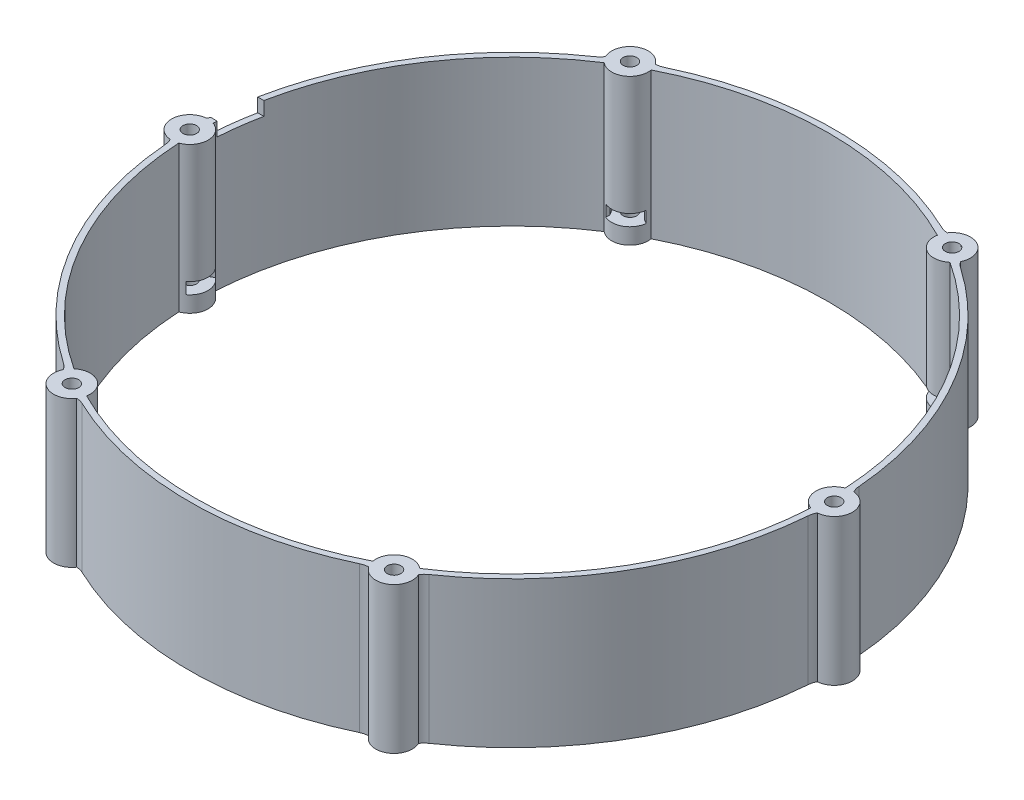
from build123d import *

# Parameters (mm, degrees)
SKETCH_1_R               = 1.5
SKETCH_1_R_2             = 4.5
EXTRUDE_1_DEPTH          = 4
FILLET_1_R               = 4
FILLET_2_R               = 4
EXTRUDE_START            = 5
EXTRUDE_2_DEPTH          = 5
CHAMFER_1_SIZE           = 0.5
EXTRUDE_START_2          = 10
SKETCH_3_R               = 1.5
EXTRUDE_3_DEPTH          = 10
CUT_EXTRUDE_1_DEPTH      = 7
CUT_EXTRUDE_1_DEPTH_BACK = 10
SKETCH_4_W               = 227.71066379
SKETCH_4_H               = 177.705724634
EXTRUDE_4_DEPTH          = 2.5
SKETCH_7_R               = 85.196987133
CUT_EXTRUDE_2_DEPTH      = 6.5
SKETCH_8_R               = 1.5
EXTRUDE_5_DEPTH          = 26
SKETCH_14_W              = 14.044577298
SKETCH_14_H              = 9
CUT_EXTRUDE_4_DEPTH      = 3


with BuildPart() as part:
    # 草图1 → 凸台-拉伸1 (new body)
    with BuildSketch(Plane(origin=(0, 0, 0), x_dir=(1, 0, 0), z_dir=(0, 1, 0))):
        with BuildLine():
            ThreePointArc((-70.5, 3), (-73.5, 0), (-70.5, -3))
            ThreePointArc((-70.5, -3), (-61.110044183, -35.281900459), (-37.848076211, -59.554790967))
            ThreePointArc((-37.848076211, -59.554790967), (-36.75, -63.652867178), (-32.651923789, -62.554790967))
            ThreePointArc((-32.651923789, -62.554790967), (0, -70.563800918), (32.651923789, -62.554790967))
            ThreePointArc((32.651923789, -62.554790967), (36.75, -63.652867178), (37.848076211, -59.554790967))
            ThreePointArc((37.848076211, -59.554790967), (61.110044183, -35.281900459), (70.5, -3))
            ThreePointArc((70.5, -3), (73.5, 0), (70.5, 3))
            ThreePointArc((70.5, 3), (61.110044183, 35.281900459), (37.848076211, 59.554790967))
            ThreePointArc((37.848076211, 59.554790967), (36.75, 63.652867178), (32.651923789, 62.554790967))
            ThreePointArc((32.651923789, 62.554790967), (0, 70.563800918), (-32.651923789, 62.554790967))
            ThreePointArc((-32.651923789, 62.554790967), (-36.75, 63.652867178), (-37.848076211, 59.554790967))
            ThreePointArc((-37.848076211, 59.554790967), (-61.110044183, 35.281900459), (-70.5, 3))
        make_face()
        with Locations(Location((-8, 0, 0), (0, 0, 270))):
            Circle(SKETCH_1_R, mode=Mode.SUBTRACT)
        with Locations(Location((0, 8, 0), (0, 0, 270))):
            Circle(SKETCH_1_R, mode=Mode.SUBTRACT)
        with Locations(Location((8, 0, 0), (0, 0, 270))):
            Circle(SKETCH_1_R, mode=Mode.SUBTRACT)
        with Locations(Location((0, -8, 0), (0, 0, 270))):
            Circle(SKETCH_1_R, mode=Mode.SUBTRACT)
        with Locations(Location((-70.5, 0, 0), (0, 0, 270))):
            Circle(SKETCH_1_R, mode=Mode.SUBTRACT)
        with Locations(Location((-35.25, 61.054790967, 0), (0, 0, 270))):
            Circle(SKETCH_1_R, mode=Mode.SUBTRACT)
        with Locations(Location((35.25, 61.054790967, 0), (0, 0, 270))):
            Circle(SKETCH_1_R, mode=Mode.SUBTRACT)
        with Locations(Location((70.5, 0, 0), (0, 0, 270))):
            Circle(SKETCH_1_R, mode=Mode.SUBTRACT)
        with Locations(Location((35.25, -61.054790967, 0), (0, 0, 270))):
            Circle(SKETCH_1_R, mode=Mode.SUBTRACT)
        with Locations(Location((-35.25, -61.054790967, 0), (0, 0, 270))):
            Circle(SKETCH_1_R, mode=Mode.SUBTRACT)
        with Locations(Location((0, 0, 0), (0, 0, 270))):
            Circle(SKETCH_1_R_2, mode=Mode.SUBTRACT)
        with BuildLine():
            Line((-9.579036496, 4.300239505), (-67.362882511, 4.300239505))
            ThreePointArc((-67.362882511, 4.300239505), (-58.456714755, 33.75), (-37.405557909, 56.187847774))
            Line((-37.405557909, 56.187847774), (-8.513634902, 6.145569197))
            ThreePointArc((-8.513634902, 6.145569197), (-9.09326674, 5.25), (-9.579036496, 4.300239505))
        make_face(mode=Mode.SUBTRACT)
        with BuildLine():
            Line((-9.579036496, -4.300239505), (-67.362882511, -4.300239505))
            ThreePointArc((-67.362882511, -4.300239505), (-58.456714755, -33.75), (-37.405557909, -56.187847774))
            Line((-37.405557909, -56.187847774), (-8.513634902, -6.145569197))
            ThreePointArc((-8.513634902, -6.145569197), (-9.09326674, -5.25), (-9.579036496, -4.300239505))
        make_face(mode=Mode.SUBTRACT)
        with BuildLine():
            Line((67.362882511, -4.300239505), (9.579036496, -4.300239505))
            ThreePointArc((9.579036496, -4.300239505), (9.09326674, -5.25), (8.513634902, -6.145569197))
            Line((8.513634902, -6.145569197), (37.405557909, -56.187847774))
            ThreePointArc((37.405557909, -56.187847774), (58.456714755, -33.75), (67.362882511, -4.300239505))
        make_face(mode=Mode.SUBTRACT)
        with BuildLine():
            Line((67.362882511, 4.300239505), (9.579036496, 4.300239505))
            ThreePointArc((9.579036496, 4.300239505), (9.09326674, 5.25), (8.513634902, 6.145569197))
            Line((8.513634902, 6.145569197), (37.405557909, 56.187847774))
            ThreePointArc((37.405557909, 56.187847774), (58.456714755, 33.75), (67.362882511, 4.300239505))
        make_face(mode=Mode.SUBTRACT)
        with BuildLine():
            Line((-1.065401594, 10.445808702), (-29.957324602, 60.488087279))
            ThreePointArc((-29.957324602, 60.488087279), (0, 67.5), (29.957324602, 60.488087279))
            Line((29.957324602, 60.488087279), (1.065401594, 10.445808702))
            ThreePointArc((1.065401594, 10.445808702), (0, 10.5), (-1.065401594, 10.445808702))
        make_face(mode=Mode.SUBTRACT)
        with BuildLine():
            Line((29.957324602, -60.488087279), (1.065401594, -10.445808702))
            ThreePointArc((1.065401594, -10.445808702), (0, -10.5), (-1.065401594, -10.445808702))
            Line((-1.065401594, -10.445808702), (-29.957324602, -60.488087279))
            ThreePointArc((-29.957324602, -60.488087279), (0, -67.5), (29.957324602, -60.488087279))
        make_face(mode=Mode.SUBTRACT)
        with BuildLine():
            Line((-32.799038106, -53.809600438), (-7.799038106, -10.508330249))
            ThreePointArc((-7.799038106, -10.508330249), (-5.75, -9.959292144), (-5.200961894, -12.008330249))
            Line((-5.200961894, -12.008330249), (-30.200961894, -55.309600438))
            ThreePointArc((-30.200961894, -55.309600438), (-32.25, -55.858638544), (-32.799038106, -53.809600438))
        make_face(mode=Mode.SUBTRACT)
        with BuildLine():
            Line((-63, 1.5), (-13, 1.5))
            ThreePointArc((-13, 1.5), (-11.5, 0), (-13, -1.5))
            Line((-13, -1.5), (-63, -1.5))
            ThreePointArc((-63, -1.5), (-64.5, 0), (-63, 1.5))
        make_face(mode=Mode.SUBTRACT)
        with BuildLine():
            Line((-30.200961894, 55.309600438), (-5.200961894, 12.008330249))
            ThreePointArc((-5.200961894, 12.008330249), (-5.75, 9.959292144), (-7.799038106, 10.508330249))
            Line((-7.799038106, 10.508330249), (-32.799038106, 53.809600438))
            ThreePointArc((-32.799038106, 53.809600438), (-32.25, 55.858638544), (-30.200961894, 55.309600438))
        make_face(mode=Mode.SUBTRACT)
        with BuildLine():
            Line((32.799038106, 53.809600438), (7.799038106, 10.508330249))
            ThreePointArc((7.799038106, 10.508330249), (5.75, 9.959292144), (5.200961894, 12.008330249))
            Line((5.200961894, 12.008330249), (30.200961894, 55.309600438))
            ThreePointArc((30.200961894, 55.309600438), (32.25, 55.858638544), (32.799038106, 53.809600438))
        make_face(mode=Mode.SUBTRACT)
        with BuildLine():
            Line((63, -1.5), (13, -1.5))
            ThreePointArc((13, -1.5), (11.5, 0), (13, 1.5))
            Line((13, 1.5), (63, 1.5))
            ThreePointArc((63, 1.5), (64.5, 0), (63, -1.5))
        make_face(mode=Mode.SUBTRACT)
        with BuildLine():
            Line((30.200961894, -55.309600438), (5.200961894, -12.008330249))
            ThreePointArc((5.200961894, -12.008330249), (5.75, -9.959292144), (7.799038106, -10.508330249))
            Line((7.799038106, -10.508330249), (32.799038106, -53.809600438))
            ThreePointArc((32.799038106, -53.809600438), (32.25, -55.858638544), (30.200961894, -55.309600438))
        make_face(mode=Mode.SUBTRACT)
    extrude(amount=EXTRUDE_1_DEPTH)

    # 圆角1
    fillet_1_edges = [part.edges().sort_by_distance(p)[0] for p in [
        (-32.651923789, 2, -62.554790967),
        (32.651923789, 2, -62.554790967),
        (37.848076211, 2, -59.554790967),
        (70.5, 2, -3),
        (70.5, 2, 3),
        (37.848076211, 2, 59.554790967),
        (32.651923789, 2, 62.554790967),
        (-32.651923789, 2, 62.554790967),
        (-37.848076211, 2, 59.554790967),
        (-70.5, 2, 3),
        (-70.5, 2, -3),
        (-37.848076211, 2, -59.554790967),
        (29.957324602, 2, 60.488087279),
        (-29.957324602, 2, 60.488087279),
        (67.362882511, 2, 4.300239505),
        (37.405557909, 2, 56.187847774),
        (37.405557909, 2, -56.187847774),
        (67.362882511, 2, -4.300239505),
        (-29.957324602, 2, -60.488087279),
        (29.957324602, 2, -60.488087279),
        (-67.362882511, 2, -4.300239505),
        (-37.405557909, 2, -56.187847774),
        (-67.362882511, 2, 4.300239505),
        (-37.405557909, 2, 56.187847774),
    ]]
    fillet(fillet_1_edges, radius=FILLET_1_R)

    # 圆角2
    # the kernel refuses this fillet: 4 mm, written as the material it adds along each edge
    with BuildSketch(Plane(origin=(-1.065401594, 0, 10.445808702), x_dir=(-0.5000000000000071, 0, 0.8660254037844346), z_dir=(0, 1, 0)), Plane(origin=(-9.579036496, 0, 4.300239505), x_dir=(-1, 0, 0), z_dir=(0, 1, 0)), Plane(origin=(-8.513634902, 0, -6.145569197), x_dir=(-0.4999999999999958, 0, -0.866025403784441), z_dir=(0, 1, 0)), Plane(origin=(1.065401594, 0, -10.445808702), x_dir=(0.5000000000000073, 0, -0.8660254037844344), z_dir=(0, 1, 0)), Plane(origin=(9.579036496, 0, -4.300239505), x_dir=(1, 0, 0), z_dir=(0, 1, 0)), Plane(origin=(8.513634902, 0, 6.145569197), x_dir=(0.4999999999999941, 0, 0.866025403784442), z_dir=(0, 1, 0))) as fillet_2_piece_1:
        with BuildLine():
            CenterArc((2.310287461, 4), FILLET_2_R, 214.919873181, 55.080126819)
            ThreePointArc((-0.969526045, 1.710278757), (-0.444646896, 0.877880484), (0, 0))
            Line((0, 0), (2.310287461, 0))
        make_face()
    extrude(amount=4)
    with BuildSketch(Plane(origin=(-8.513634902, 0, 6.145569197), x_dir=(-0.5068146140540679, 0, -0.8620550718957729), z_dir=(0, 1, 0)), Plane(origin=(-9.579036496, 0, -4.300239505), x_dir=(0.49315428469593503, 0, -0.86994186672791), z_dir=(0, 1, 0)), Plane(origin=(-1.065401594, 0, -10.445808702), x_dir=(0.9999688987499935, 0, -0.007886794832196306), z_dir=(0, 1, 0)), Plane(origin=(8.513634902, 0, -6.145569197), x_dir=(0.5068146140541091, 0, 0.8620550718957487), z_dir=(0, 1, 0)), Plane(origin=(9.579036496, 0, 4.300239505), x_dir=(-0.49315428469592015, 0, 0.8699418667279183), z_dir=(0, 1, 0))) as fillet_2_piece_2:
        with BuildLine():
            CenterArc((2.340439307, 3.982432925), FILLET_2_R, 209.548115257, 55.080126819)
            Line((-1.13932816, 2.009815786), (0, 0))
            ThreePointArc((0, 0), (0.982984509, 0.046113572), (1.965969018, 0))
        make_face()
    extrude(amount=4)
    with BuildSketch(Plane(origin=(1.065401594, 0, 10.445808702), x_dir=(0.4999999999999959, 0, 0.8660254037844409), z_dir=(0, 1, 0))) as fillet_2_piece_3:
        with BuildLine():
            CenterArc((2.310287461, -4), FILLET_2_R, 90, 55.080126819)
            ThreePointArc((-0.969526045, -1.710278757), (-0.444646896, -0.877880484), (0, 0))
            Line((0, 0), (2.310287461, 0))
        make_face()
    extrude(amount=4)

    # 草图2 → 凸台-拉伸2 (add)
    with BuildSketch(Plane(origin=(0, 0, 0), x_dir=(-1, 0, 0), z_dir=(0, -1, 0)).offset(EXTRUDE_START)):
        with BuildLine():
            Line((23.086359674, -63.429251903), (23.599389889, -64.838790834))
            ThreePointArc((23.599389889, -64.838790834), (0, -69), (-23.599389889, -64.838790834))
            Line((-23.599389889, -64.838790834), (-23.086359674, -63.429251903))
            ThreePointArc((-23.086359674, -63.429251903), (0, -67.5), (23.086359674, -63.429251903))
        make_face()
        with BuildLine():
            Line((-43.388163654, -51.707999911), (-44.352345068, -52.857066575))
            ThreePointArc((-44.352345068, -52.857066575), (-59.755752861, -34.5), (-67.951734958, -11.981724259))
            Line((-67.951734958, -11.981724259), (-66.474523328, -11.721251993))
            ThreePointArc((-66.474523328, -11.721251993), (-58.456714755, -33.75), (-43.388163654, -51.707999911))
        make_face()
        with BuildLine():
            Line((-66.474523328, 11.721251993), (-67.951734958, 11.981724259))
            ThreePointArc((-67.951734958, 11.981724259), (-59.755752861, 34.5), (-44.352345068, 52.857066575))
            Line((-44.352345068, 52.857066575), (-43.388163654, 51.707999911))
            ThreePointArc((-43.388163654, 51.707999911), (-58.456714755, 33.75), (-66.474523328, 11.721251993))
        make_face()
        with BuildLine():
            Line((-23.086359674, 63.429251903), (-23.599389889, 64.838790834))
            ThreePointArc((-23.599389889, 64.838790834), (0, 69), (23.599389889, 64.838790834))
            Line((23.599389889, 64.838790834), (23.086359674, 63.429251903))
            ThreePointArc((23.086359674, 63.429251903), (0, 67.5), (-23.086359674, 63.429251903))
        make_face()
        with BuildLine():
            Line((43.388163654, 51.707999911), (44.352345068, 52.857066575))
            ThreePointArc((44.352345068, 52.857066575), (59.755752861, 34.5), (67.951734958, 11.981724259))
            Line((67.951734958, 11.981724259), (66.474523328, 11.721251993))
            ThreePointArc((66.474523328, 11.721251993), (58.456714755, 33.75), (43.388163654, 51.707999911))
        make_face()
        with BuildLine():
            Line((66.474523328, -11.721251993), (67.951734958, -11.981724259))
            ThreePointArc((67.951734958, -11.981724259), (59.755752861, -34.5), (44.352345068, -52.857066575))
            Line((44.352345068, -52.857066575), (43.388163654, -51.707999911))
            ThreePointArc((43.388163654, -51.707999911), (58.456714755, -33.75), (66.474523328, -11.721251993))
        make_face()
    extrude(amount=-EXTRUDE_2_DEPTH)

    # 倒角1
    chamfer_1_edges = [part.edges().sort_by_distance(p)[0] for p in [
        (0, -5, 69),
        (59.755752861, -5, 34.5),
        (59.755752861, -5, -34.5),
        (0, -5, -69),
        (-59.755752861, -5, -34.5),
        (-59.755752861, -5, 34.5),
    ]]
    chamfer(chamfer_1_edges, length=CHAMFER_1_SIZE)

    # 草图4 → 切除-拉伸1 (cut, two sides: drawn at the far end of the back side and taken through both)
    with BuildSketch(Plane(origin=(0, 0, 0), x_dir=(-1, 0, 0), z_dir=(0, -1, 0)).offset(-CUT_EXTRUDE_1_DEPTH_BACK)):
        Rectangle(SKETCH_4_W, SKETCH_4_H)
    extrude(amount=CUT_EXTRUDE_1_DEPTH + CUT_EXTRUDE_1_DEPTH_BACK, mode=Mode.SUBTRACT)


with BuildPart() as body_2:
    # 草图3 → 凸台-拉伸3 (new body)
    with BuildSketch(Plane.XZ.offset(EXTRUDE_START_2)):
        with BuildLine():
            ThreePointArc((70.796400557, -3.989003223), (74.5, 0), (70.796400557, 3.989003223))
            ThreePointArc((70.796400557, 3.989003223), (70.49170404, 4.742901972), (70.345766695, 5.542842958))
            ThreePointArc((70.345766695, 5.542842958), (61.110044183, 35.281900459), (39.973126159, 58.149799528))
            ThreePointArc((39.973126159, 58.149799528), (39.353325615, 58.676155469), (38.852778405, 59.316979767))
            ThreePointArc((38.852778405, 59.316979767), (37.25, 64.518892582), (31.943622152, 63.30598299))
            ThreePointArc((31.943622152, 63.30598299), (31.138378425, 63.419057441), (30.372640536, 63.692642486))
            ThreePointArc((30.372640536, 63.692642486), (0, 70.563800918), (-30.372640536, 63.692642486))
            ThreePointArc((-30.372640536, 63.692642486), (-31.138378425, 63.419057441), (-31.943622152, 63.30598299))
            ThreePointArc((-31.943622152, 63.30598299), (-37.25, 64.518892582), (-38.852778405, 59.316979767))
            ThreePointArc((-38.852778405, 59.316979767), (-39.353325615, 58.676155469), (-39.973126159, 58.149799528))
            ThreePointArc((-39.973126159, 58.149799528), (-61.110044183, 35.281900459), (-70.345766695, 5.542842958))
            ThreePointArc((-70.345766695, 5.542842958), (-70.49170404, 4.742901972), (-70.796400557, 3.989003223))
            ThreePointArc((-70.796400557, 3.989003223), (-74.5, 0), (-70.796400557, -3.989003223))
            ThreePointArc((-70.796400557, -3.989003223), (-70.49170404, -4.742901972), (-70.345766695, -5.542842958))
            ThreePointArc((-70.345766695, -5.542842958), (-61.110044183, -35.281900459), (-39.973126159, -58.149799528))
            ThreePointArc((-39.973126159, -58.149799528), (-39.353325615, -58.676155469), (-38.852778405, -59.316979767))
            ThreePointArc((-38.852778405, -59.316979767), (-37.25, -64.518892582), (-31.943622152, -63.30598299))
            ThreePointArc((-31.943622152, -63.30598299), (-31.138378425, -63.419057441), (-30.372640536, -63.692642486))
            ThreePointArc((-30.372640536, -63.692642486), (0, -70.563800918), (30.372640536, -63.692642486))
            ThreePointArc((30.372640536, -63.692642486), (31.138378425, -63.419057441), (31.943622152, -63.30598299))
            ThreePointArc((31.943622152, -63.30598299), (37.25, -64.518892582), (38.852778405, -59.316979767))
            ThreePointArc((38.852778405, -59.316979767), (39.353325615, -58.676155469), (39.973126159, -58.149799528))
            ThreePointArc((39.973126159, -58.149799528), (61.110044183, -35.281900459), (70.345766695, -5.542842958))
            ThreePointArc((70.345766695, -5.542842958), (70.49170404, -4.742901972), (70.796400557, -3.989003223))
        make_face()
        with Locations(Location((70.5, 0, 0), (0, 0, 270))):
            Circle(SKETCH_3_R, mode=Mode.SUBTRACT)
        with Locations(Location((35.25, 61.054790967, 0), (0, 0, 270))):
            Circle(SKETCH_3_R, mode=Mode.SUBTRACT)
        with Locations(Location((-35.25, 61.054790967, 0), (0, 0, 270))):
            Circle(SKETCH_3_R, mode=Mode.SUBTRACT)
        with Locations(Location((-70.5, 0, 0), (0, 0, 270))):
            Circle(SKETCH_3_R, mode=Mode.SUBTRACT)
        with Locations(Location((-35.25, -61.054790967, 0), (0, 0, 270))):
            Circle(SKETCH_3_R, mode=Mode.SUBTRACT)
        with Locations(Location((35.25, -61.054790967, 0), (0, 0, 270))):
            Circle(SKETCH_3_R, mode=Mode.SUBTRACT)
        with BuildLine():
            ThreePointArc((-37.833906507, 58.001362212), (-59.972259212, 34.625), (-69.147606383, 3.764443054))
            ThreePointArc((-69.147606383, 3.764443054), (-66.5, 0), (-69.147606383, -3.764443054))
            ThreePointArc((-69.147606383, -3.764443054), (-59.972259212, -34.625), (-37.833906507, -58.001362212))
            ThreePointArc((-37.833906507, -58.001362212), (-33.25, -57.590689352), (-31.313699876, -61.765805265))
            ThreePointArc((-31.313699876, -61.765805265), (0, -69.25), (31.313699876, -61.765805265))
            ThreePointArc((31.313699876, -61.765805265), (33.25, -57.590689352), (37.833906507, -58.001362212))
            ThreePointArc((37.833906507, -58.001362212), (59.972259212, -34.625), (69.147606383, -3.764443054))
            ThreePointArc((69.147606383, -3.764443054), (66.5, 0), (69.147606383, 3.764443054))
            ThreePointArc((69.147606383, 3.764443054), (59.972259212, 34.625), (37.833906507, 58.001362212))
            ThreePointArc((37.833906507, 58.001362212), (33.25, 57.590689352), (31.313699876, 61.765805265))
            ThreePointArc((31.313699876, 61.765805265), (0, 69.25), (-31.313699876, 61.765805265))
            ThreePointArc((-31.313699876, 61.765805265), (-33.25, 57.590689352), (-37.833906507, 58.001362212))
        make_face(mode=Mode.SUBTRACT)
    extrude(amount=EXTRUDE_3_DEPTH)

    # 草图5 → 凸台-拉伸4 (add)
    with BuildSketch(Plane(origin=(0, -10, 0), x_dir=(1, 0, 0), z_dir=(0, 1, 0))):
        with BuildLine():
            ThreePointArc((30.372640536, 63.692642486), (0, 70.563800918), (-30.372640536, 63.692642486))
            ThreePointArc((-30.372640536, 63.692642486), (-31.138378425, 63.419057441), (-31.943622152, 63.30598299))
            ThreePointArc((-31.943622152, 63.30598299), (-37.25, 64.518892582), (-38.852778405, 59.316979767))
            ThreePointArc((-38.852778405, 59.316979767), (-39.353325615, 58.676155469), (-39.973126159, 58.149799528))
            ThreePointArc((-39.973126159, 58.149799528), (-61.110044183, 35.281900459), (-70.345766695, 5.542842958))
            ThreePointArc((-70.345766695, 5.542842958), (-70.49170404, 4.742901972), (-70.796400557, 3.989003223))
            ThreePointArc((-70.796400557, 3.989003223), (-74.5, 0), (-70.796400557, -3.989003223))
            ThreePointArc((-70.796400557, -3.989003223), (-70.49170404, -4.742901972), (-70.345766695, -5.542842958))
            ThreePointArc((-70.345766695, -5.542842958), (-61.110044183, -35.281900459), (-39.973126159, -58.149799528))
            ThreePointArc((-39.973126159, -58.149799528), (-39.353325615, -58.676155469), (-38.852778405, -59.316979767))
            ThreePointArc((-38.852778405, -59.316979767), (-37.25, -64.518892582), (-31.943622152, -63.30598299))
            ThreePointArc((-31.943622152, -63.30598299), (-31.138378425, -63.419057441), (-30.372640536, -63.692642486))
            ThreePointArc((-30.372640536, -63.692642486), (0, -70.563800918), (30.372640536, -63.692642486))
            ThreePointArc((30.372640536, -63.692642486), (31.138378425, -63.419057441), (31.943622152, -63.30598299))
            ThreePointArc((31.943622152, -63.30598299), (37.25, -64.518892582), (38.852778405, -59.316979767))
            ThreePointArc((38.852778405, -59.316979767), (39.353325615, -58.676155469), (39.973126159, -58.149799528))
            ThreePointArc((39.973126159, -58.149799528), (61.110044183, -35.281900459), (70.345766695, -5.542842958))
            ThreePointArc((70.345766695, -5.542842958), (70.49170404, -4.742901972), (70.796400557, -3.989003223))
            ThreePointArc((70.796400557, -3.989003223), (74.5, 0), (70.796400557, 3.989003223))
            ThreePointArc((70.796400557, 3.989003223), (70.49170404, 4.742901972), (70.345766695, 5.542842958))
            ThreePointArc((70.345766695, 5.542842958), (61.110044183, 35.281900459), (39.973126159, 58.149799528))
            ThreePointArc((39.973126159, 58.149799528), (39.353325615, 58.676155469), (38.852778405, 59.316979767))
            ThreePointArc((38.852778405, 59.316979767), (37.25, 64.518892582), (31.943622152, 63.30598299))
            ThreePointArc((31.943622152, 63.30598299), (31.138378425, 63.419057441), (30.372640536, 63.692642486))
        make_face()
        with BuildLine():
            Line((-32.016838493, 61.054790967), (-33.633419246, 63.854790967))
            Line((-33.633419246, 63.854790967), (-36.866580754, 63.854790967))
            Line((-36.866580754, 63.854790967), (-38.483161507, 61.054790967))
            Line((-38.483161507, 61.054790967), (-36.866580754, 58.254790967))
            Line((-36.866580754, 58.254790967), (-36.866580754, 57.396011571))
            ThreePointArc((-36.866580754, 57.396011571), (-37.371941483, 57.664014604), (-37.833906507, 58.001362212))
            ThreePointArc((-37.833906507, 58.001362212), (-59.972259212, 34.625), (-69.147606383, 3.764443054))
            ThreePointArc((-69.147606383, 3.764443054), (-68.624472273, 3.533043411), (-68.139694473, 3.229389698))
            Line((-68.139694473, 3.229389698), (-68.883419246, 2.8))
            Line((-68.883419246, 2.8), (-72.116580754, 2.8))
            Line((-72.116580754, 2.8), (-73.733161507, 0))
            Line((-73.733161507, 0), (-72.116580754, -2.8))
            Line((-72.116580754, -2.8), (-68.883419246, -2.8))
            Line((-68.883419246, -2.8), (-68.139694473, -3.229389698))
            ThreePointArc((-68.139694473, -3.229389698), (-68.624472273, -3.533043411), (-69.147606383, -3.764443054))
            ThreePointArc((-69.147606383, -3.764443054), (-59.972259212, -34.625), (-37.833906507, -58.001362212))
            ThreePointArc((-37.833906507, -58.001362212), (-37.371941483, -57.664014604), (-36.866580754, -57.396011571))
            Line((-36.866580754, -57.396011571), (-36.866580754, -58.254790967))
            Line((-36.866580754, -58.254790967), (-38.483161507, -61.054790967))
            Line((-38.483161507, -61.054790967), (-36.866580754, -63.854790967))
            Line((-36.866580754, -63.854790967), (-33.633419246, -63.854790967))
            Line((-33.633419246, -63.854790967), (-32.016838493, -61.054790967))
            Line((-32.016838493, -61.054790967), (-31.27311372, -60.625401269))
            ThreePointArc((-31.27311372, -60.625401269), (-31.25253079, -61.197058015), (-31.313699876, -61.765805265))
            ThreePointArc((-31.313699876, -61.765805265), (0, -69.25), (31.313699876, -61.765805265))
            ThreePointArc((31.313699876, -61.765805265), (31.25253079, -61.197058015), (31.27311372, -60.625401269))
            Line((31.27311372, -60.625401269), (32.016838493, -61.054790967))
            Line((32.016838493, -61.054790967), (33.633419246, -63.854790967))
            Line((33.633419246, -63.854790967), (36.866580754, -63.854790967))
            Line((36.866580754, -63.854790967), (38.483161507, -61.054790967))
            Line((38.483161507, -61.054790967), (36.866580754, -58.254790967))
            Line((36.866580754, -58.254790967), (36.866580754, -57.396011571))
            ThreePointArc((36.866580754, -57.396011571), (37.371941483, -57.664014604), (37.833906507, -58.001362212))
            ThreePointArc((37.833906507, -58.001362212), (59.972259212, -34.625), (69.147606383, -3.764443054))
            ThreePointArc((69.147606383, -3.764443054), (68.624472273, -3.533043411), (68.139694473, -3.229389698))
            Line((68.139694473, -3.229389698), (68.883419246, -2.8))
            Line((68.883419246, -2.8), (72.116580754, -2.8))
            Line((72.116580754, -2.8), (73.733161507, 0))
            Line((73.733161507, 0), (72.116580754, 2.8))
            Line((72.116580754, 2.8), (68.883419246, 2.8))
            Line((68.883419246, 2.8), (68.139694473, 3.229389698))
            ThreePointArc((68.139694473, 3.229389698), (68.624472273, 3.533043411), (69.147606383, 3.764443054))
            ThreePointArc((69.147606383, 3.764443054), (59.972259212, 34.625), (37.833906507, 58.001362212))
            ThreePointArc((37.833906507, 58.001362212), (37.371941483, 57.664014604), (36.866580754, 57.396011571))
            Line((36.866580754, 57.396011571), (36.866580754, 58.254790967))
            Line((36.866580754, 58.254790967), (38.483161507, 61.054790967))
            Line((38.483161507, 61.054790967), (36.866580754, 63.854790967))
            Line((36.866580754, 63.854790967), (33.633419246, 63.854790967))
            Line((33.633419246, 63.854790967), (32.016838493, 61.054790967))
            Line((32.016838493, 61.054790967), (31.27311372, 60.625401269))
            ThreePointArc((31.27311372, 60.625401269), (31.25253079, 61.197058015), (31.313699876, 61.765805265))
            ThreePointArc((31.313699876, 61.765805265), (0, 69.25), (-31.313699876, 61.765805265))
            ThreePointArc((-31.313699876, 61.765805265), (-31.25253079, 61.197058015), (-31.27311372, 60.625401269))
            Line((-31.27311372, 60.625401269), (-32.016838493, 61.054790967))
        make_face(mode=Mode.SUBTRACT)
    extrude(amount=EXTRUDE_4_DEPTH)

    # 草图7 → 切除-拉伸2 (cut)
    with BuildSketch(Plane(origin=(0, -20, 0), x_dir=(-1, 0, 0), z_dir=(0, -1, 0))):
        Circle(SKETCH_7_R)
    extrude(amount=-CUT_EXTRUDE_2_DEPTH, mode=Mode.SUBTRACT)

    # 草图8 → 凸台-拉伸5 (add)
    with BuildSketch(Plane(origin=(0, -7.5, 0), x_dir=(1, 0, 0), z_dir=(0, 1, 0))):
        with BuildLine():
            ThreePointArc((38.852778405, 59.316979767), (39.353325615, 58.676155469), (39.973126159, 58.149799528))
            ThreePointArc((39.973126159, 58.149799528), (61.110044183, 35.281900459), (70.345766695, 5.542842958))
            ThreePointArc((70.345766695, 5.542842958), (70.49170404, 4.742901972), (70.796400557, 3.989003223))
            ThreePointArc((70.796400557, 3.989003223), (74.5, 0), (70.796400557, -3.989003223))
            ThreePointArc((70.796400557, -3.989003223), (70.49170404, -4.742901972), (70.345766695, -5.542842958))
            ThreePointArc((70.345766695, -5.542842958), (61.110044183, -35.281900459), (39.973126159, -58.149799528))
            ThreePointArc((39.973126159, -58.149799528), (39.353325615, -58.676155469), (38.852778405, -59.316979767))
            ThreePointArc((38.852778405, -59.316979767), (37.25, -64.518892582), (31.943622152, -63.30598299))
            ThreePointArc((31.943622152, -63.30598299), (31.138378425, -63.419057441), (30.372640536, -63.692642486))
            ThreePointArc((30.372640536, -63.692642486), (0, -70.563800918), (-30.372640536, -63.692642486))
            ThreePointArc((-30.372640536, -63.692642486), (-31.138378425, -63.419057441), (-31.943622152, -63.30598299))
            ThreePointArc((-31.943622152, -63.30598299), (-37.25, -64.518892582), (-38.852778405, -59.316979767))
            ThreePointArc((-38.852778405, -59.316979767), (-39.353325615, -58.676155469), (-39.973126159, -58.149799528))
            ThreePointArc((-39.973126159, -58.149799528), (-61.110044183, -35.281900459), (-70.345766695, -5.542842958))
            ThreePointArc((-70.345766695, -5.542842958), (-70.49170404, -4.742901972), (-70.796400557, -3.989003223))
            ThreePointArc((-70.796400557, -3.989003223), (-74.5, 0), (-70.796400557, 3.989003223))
            ThreePointArc((-70.796400557, 3.989003223), (-70.49170404, 4.742901972), (-70.345766695, 5.542842958))
            ThreePointArc((-70.345766695, 5.542842958), (-61.110044183, 35.281900459), (-39.973126159, 58.149799528))
            ThreePointArc((-39.973126159, 58.149799528), (-39.353325615, 58.676155469), (-38.852778405, 59.316979767))
            ThreePointArc((-38.852778405, 59.316979767), (-37.25, 64.518892582), (-31.943622152, 63.30598299))
            ThreePointArc((-31.943622152, 63.30598299), (-31.138378425, 63.419057441), (-30.372640536, 63.692642486))
            ThreePointArc((-30.372640536, 63.692642486), (0, 70.563800918), (30.372640536, 63.692642486))
            ThreePointArc((30.372640536, 63.692642486), (31.138378425, 63.419057441), (31.943622152, 63.30598299))
            ThreePointArc((31.943622152, 63.30598299), (37.25, 64.518892582), (38.852778405, 59.316979767))
        make_face()
        with Locations(Location((-70.5, 0, 0), (0, 0, 90))):
            Circle(SKETCH_8_R, mode=Mode.SUBTRACT)
        with Locations(Location((-35.25, 61.054790967, 0), (0, 0, 90))):
            Circle(SKETCH_8_R, mode=Mode.SUBTRACT)
        with Locations(Location((35.25, 61.054790967, 0), (0, 0, 90))):
            Circle(SKETCH_8_R, mode=Mode.SUBTRACT)
        with Locations(Location((70.5, 0, 0), (0, 0, 90))):
            Circle(SKETCH_8_R, mode=Mode.SUBTRACT)
        with Locations(Location((35.25, -61.054790967, 0), (0, 0, 90))):
            Circle(SKETCH_8_R, mode=Mode.SUBTRACT)
        with Locations(Location((-35.25, -61.054790967, 0), (0, 0, 89.999999999))):
            Circle(SKETCH_8_R, mode=Mode.SUBTRACT)
        with BuildLine():
            ThreePointArc((-69.147606383, -3.764443054), (-59.972259212, -34.625), (-37.833906507, -58.001362212))
            ThreePointArc((-37.833906507, -58.001362212), (-33.25, -57.590689352), (-31.313699876, -61.765805265))
            ThreePointArc((-31.313699876, -61.765805265), (0, -69.25), (31.313699876, -61.765805265))
            ThreePointArc((31.313699876, -61.765805265), (33.25, -57.590689352), (37.833906507, -58.001362212))
            ThreePointArc((37.833906507, -58.001362212), (59.972259212, -34.625), (69.147606383, -3.764443054))
            ThreePointArc((69.147606383, -3.764443054), (66.5, 0), (69.147606383, 3.764443054))
            ThreePointArc((69.147606383, 3.764443054), (59.972259212, 34.625), (37.833906507, 58.001362212))
            ThreePointArc((37.833906507, 58.001362212), (33.25, 57.590689352), (31.313699876, 61.765805265))
            ThreePointArc((31.313699876, 61.765805265), (0, 69.25), (-31.313699876, 61.765805265))
            ThreePointArc((-31.313699876, 61.765805265), (-33.25, 57.590689352), (-37.833906507, 58.001362212))
            ThreePointArc((-37.833906507, 58.001362212), (-59.972259212, 34.625), (-69.147606383, 3.764443054))
            ThreePointArc((-69.147606383, 3.764443054), (-66.5, 0), (-69.147606383, -3.764443054))
        make_face(mode=Mode.SUBTRACT)
    extrude(amount=EXTRUDE_5_DEPTH)

    # 草图14 → 切除-拉伸4 (cut)
    with BuildSketch(Plane(origin=(0, 18.5, 0), x_dir=(1, 0, 0), z_dir=(0, 1, 0))):
        with Locations((-71.719803025, 9.097000999)):
            Rectangle(SKETCH_14_W, SKETCH_14_H)
    extrude(amount=-CUT_EXTRUDE_4_DEPTH, mode=Mode.SUBTRACT)


solid = body_2.part
